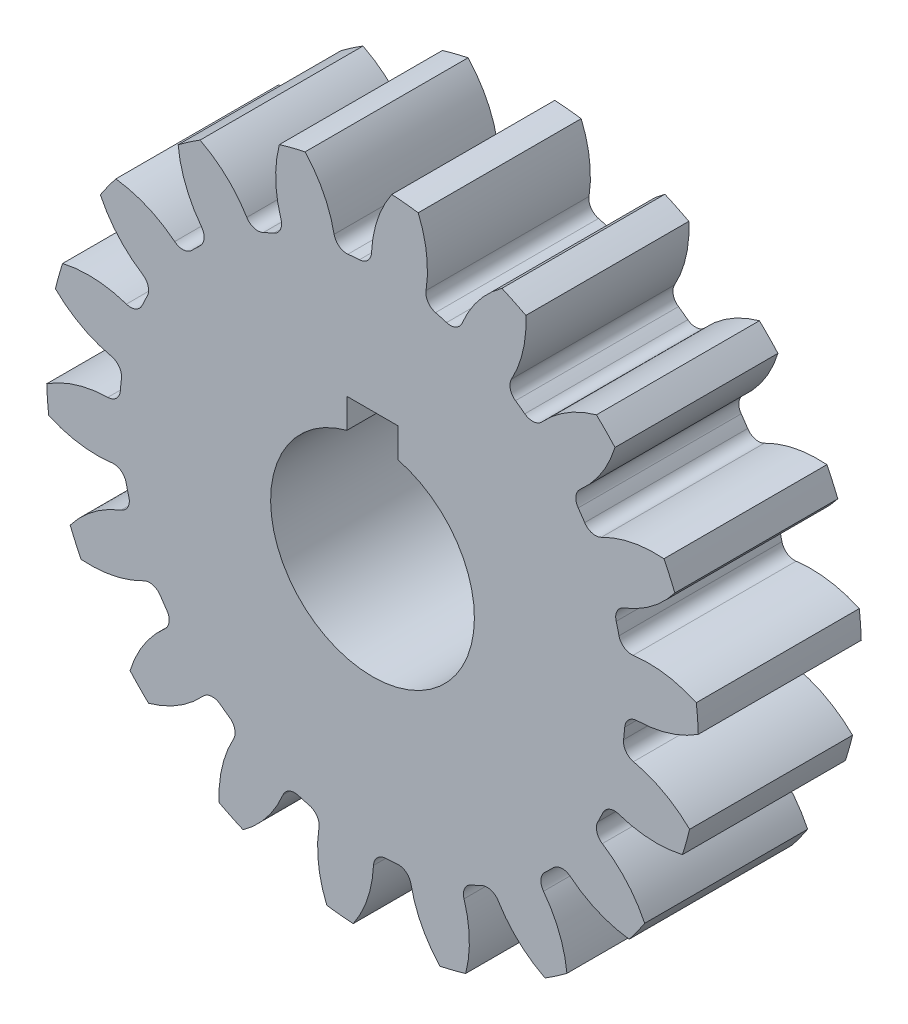
from build123d import *

# Parameters (mm, degrees)
SKETCH3_R         = 12.7
GEARBODY_DEPTH    = 6.35
TOOTHCUT_DEPTH    = 20.05
CIRPATTERN1_COUNT = 18
BORE_DEPTH        = 12.7


with BuildPart() as part:
    # Sketch3 → gearBody (new body)
    with BuildSketch(Plane.XY):
        Circle(SKETCH3_R)
    extrude(amount=GEARBODY_DEPTH)

    # Sketch2 → toothCut (cut, through all)
    with BuildSketch(Plane.XY):
        with BuildLine():
            ThreePointArc((9.781229257, -1.205205904), (9.806057787, -0.982953571), (9.825836884, -0.760195085))
            ThreePointArc((9.825836884, -0.760195085), (9.980803767, -0.435792976), (10.31355819, -0.299682883))
            ThreePointArc((10.31355819, -0.299682883), (12.38209996, 0.246018063), (13.970369973, 1.679214819))
            ThreePointArc((13.970369973, 1.679214819), (14.000763839, -1.403428484), (13.359117821, -4.418706897))
            ThreePointArc((13.359117821, -4.418706897), (12.0869153, -2.698778026), (10.167842346, -1.753360882))
            ThreePointArc((10.167842346, -1.753360882), (9.868724138, -1.553912241), (9.781229257, -1.205205904))
        make_face()
    toothcut = extrude(amount=TOOTHCUT_DEPTH, mode=Mode.SUBTRACT)

    # CirPattern1: toothCut ×18 about axis
    cirpattern1_axis = Axis((0, 0, 6.35), (0, 0, -1))
    for i in range(1, CIRPATTERN1_COUNT):
        add(toothcut.rotate(cirpattern1_axis, i * 360 / CIRPATTERN1_COUNT), mode=Mode.SUBTRACT)

    # boreDia → bore (cut, symmetric)
    with BuildSketch(Plane.XY):
        with BuildLine():
            Line((-1, 3.842012337), (-1, 4.992632337))
            Line((-1, 4.992632337), (1, 4.992632337))
            Line((1, 4.992632337), (1, 3.842012337))
            ThreePointArc((1, 3.842012337), (0, -3.97002), (-1, 3.842012337))
        make_face()
    extrude(amount=BORE_DEPTH, both=True, mode=Mode.SUBTRACT)


solid = part.part
